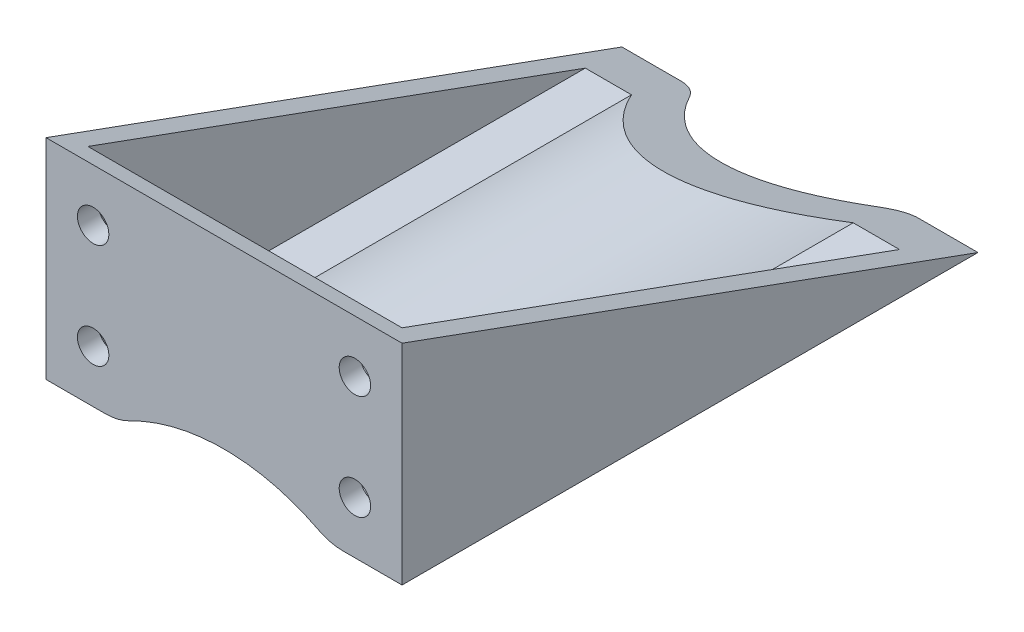
from build123d import *

# Parameters (mm, degrees)
SALIENTE_EXTRUIR3_DEPTH = 34
CROQUIS6_R              = 19.75
CORTAR_EXTRUIR2_DEPTH   = 68.683085036
VACIADO3_T              = -2
CROQUIS5_R              = 1.5
CORTAR_EXTRUIR3_DEPTH   = 10
REDONDEO1_R             = 5


with BuildPart() as part:
    # Croquis4 → Saliente-Extruir3 (new body)
    with BuildSketch(Plane(origin=(0, 0, 0), x_dir=(0, 0, -1), z_dir=(1, 0, 0))):
        Polygon((0, 0), (55, 0), (0, 20), align=None)
    extrude(amount=SALIENTE_EXTRUIR3_DEPTH)

    # Croquis6 → Cortar-Extruir2 (cut, through all)
    with BuildSketch(Plane.XY):
        with Locations((17, -17)):
            Circle(CROQUIS6_R)
    extrude(amount=-CORTAR_EXTRUIR2_DEPTH, mode=Mode.SUBTRACT)

    # Vaciado3
    vaciado3_openings = [part.faces().sort_by_distance(p)[0] for p in [
        (17, 10.517691614, -26.076348062),
    ]]
    offset(amount=VACIADO3_T, openings=vaciado3_openings, kind=Kind.INTERSECTION)

    # Croquis5 → Cortar-Extruir3 (cut)
    with BuildSketch(Plane.XY):
        with Locations((4.5, 15)):
            Circle(CROQUIS5_R)
        with Locations((29.5, 15)):
            Circle(CROQUIS5_R)
        with Locations((29.5, 5)):
            Circle(CROQUIS5_R)
        with Locations((4.5, 5)):
            Circle(CROQUIS5_R)
    extrude(amount=-CORTAR_EXTRUIR3_DEPTH, mode=Mode.SUBTRACT)

    # Redondeo1
    redondeo1_edges = [part.edges().sort_by_distance(p)[0] for p in [
        (6.947015369, 0, -27.5),
        (27.052984631, 0, -27.5),
    ]]
    fillet(redondeo1_edges, radius=REDONDEO1_R)


solid = part.part
